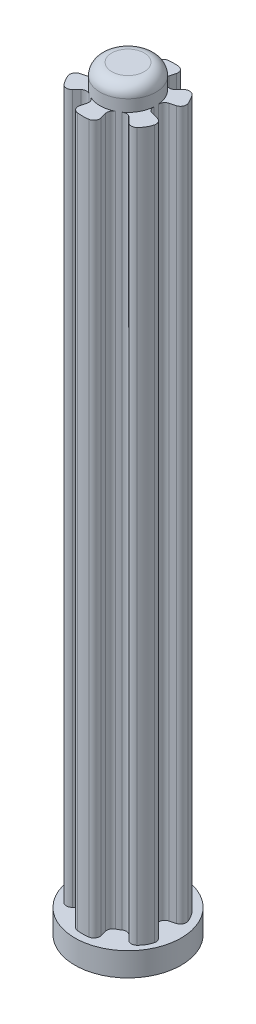
from build123d import *

# Parameters (mm, degrees)
BOSS_EXTRUDE1_DEPTH = 60
SKETCH3_R           = 4.5
BOSS_EXTRUDE2_DEPTH = 2
SKETCH4_R           = 2.375
BOSS_EXTRUDE3_DEPTH = 2
FILLET1_R           = 0.5
SKETCH6_R           = 1
CUT_EXTRUDE4_DEPTH  = 0.5
CUT_EXTRUDE4_DRAFT  = -50
FILLET2_R           = 1


with BuildPart() as part:
    # Sketch2 → Boss-Extrude1 (new body)
    with BuildSketch(Plane(origin=(0, 0, 0), x_dir=(1, 0, 0), z_dir=(0, 1, 0))):
        with BuildLine():
            Line((3.775215965, -0.978645895), (2.300774305, -0.58912019))
            ThreePointArc((2.300774305, -0.58912019), (2.374963211, 0.013219106), (2.294073837, 0.614695232))
            Line((2.294073837, 0.614695232), (3.742962577, 1.0029238))
            ThreePointArc((3.742962577, 1.0029238), (3.356294138, 1.936727823), (2.741299364, 2.73877761))
            Line((2.741299364, 2.73877761), (1.680151223, 1.678605632))
            ThreePointArc((1.680151223, 1.678605632), (1.187973207, 2.056537055), (0.614695232, 2.294073837))
            Line((0.614695232, 2.294073837), (1.0029238, 3.742962577))
            ThreePointArc((1.0029238, 3.742962577), (0, 3.875), (-1.0029238, 3.742962577))
            Line((-1.0029238, 3.742962577), (-0.614695232, 2.294073837))
            ThreePointArc((-0.614695232, 2.294073837), (-1.1875, 2.056810334), (-1.679378605, 1.679378605))
            Line((-1.679378605, 1.679378605), (-2.740038777, 2.740038777))
            ThreePointArc((-2.740038777, 2.740038777), (-3.35584844, 1.9375), (-3.742962577, 1.0029238))
            Line((-3.742962577, 1.0029238), (-2.294073837, 0.614695232))
            ThreePointArc((-2.294073837, 0.614695232), (-2.375, 0), (-2.294073837, -0.614695232))
            Line((-2.294073837, -0.614695232), (-3.742962577, -1.0029238))
            ThreePointArc((-3.742962577, -1.0029238), (-3.35584844, -1.9375), (-2.740038777, -2.740038777))
            Line((-2.740038777, -2.740038777), (-1.679378605, -1.679378605))
            ThreePointArc((-1.679378605, -1.679378605), (-1.1875, -2.056810334), (-0.614695232, -2.294073837))
            Line((-0.614695232, -2.294073837), (-1.0029238, -3.742962577))
            ThreePointArc((-1.0029238, -3.742962577), (0.033967076, -3.874851125), (1.068386506, -3.724805401))
            Line((1.068386506, -3.724805401), (0.681359786, -2.275164575))
            ThreePointArc((0.681359786, -2.275164575), (1.238849907, -2.026296106), (1.714477211, -1.643530618))
            Line((1.714477211, -1.643530618), (2.767163136, -2.698133353))
            ThreePointArc((2.767163136, -2.698133353), (3.500652231, -1.972912562), (3.775215965, -0.978645895))
        make_face()
        Polygon((0.085836926, -0.044584082), (0, 0), (0.073933818, 0), (0.104207494, -0.030328801), (0.080162685, -0.023330742), align=None, mode=Mode.SUBTRACT)
    extrude(amount=BOSS_EXTRUDE1_DEPTH)

    # Sketch3 → Boss-Extrude2 (add)
    with BuildSketch(Plane.XZ):
        with Locations(Location((0, 0, 0), (0, 0, 270))):
            Circle(SKETCH3_R)
    extrude(amount=BOSS_EXTRUDE2_DEPTH)

    # Sketch4 → Boss-Extrude3 (add)
    with BuildSketch(Plane(origin=(0, 60, 0), x_dir=(1, 0, 0), z_dir=(0, 1, 0))):
        with Locations(Location((0, 0, 0), (0, 0, 75))):
            Circle(SKETCH4_R)
    extrude(amount=BOSS_EXTRUDE3_DEPTH)

    # Fillet1
    # the kernel refuses this fillet: 0.5 mm, written as the material it adds along each edge
    with BuildSketch(Plane(origin=(-2.294073837, -1.140469783, 0.614695232), x_dir=(-0.965925826289068, 0, 0.2588190451025218), z_dir=(0, 1, 0)), Plane(origin=(-1.679378605, -1.140469783, -1.679378605), x_dir=(-0.7071067811865478, 0, -0.7071067811865474), z_dir=(0, 1, 0)), Plane(origin=(0.614695232, -1.140469783, -2.294073837), x_dir=(0.2588190451025215, 0, -0.9659258262890681), z_dir=(0, 1, 0)), Plane(origin=(2.294073837, -1.140469783, -0.614695232), x_dir=(0.9659258262890681, 0, -0.2588190451025215), z_dir=(0, 1, 0)), Plane(origin=(-0.614695232, -1.140469783, 2.294073837), x_dir=(-0.2588190451025215, 0, 0.9659258262890681), z_dir=(0, 1, 0))) as fillet1_piece_1:
        with BuildLine():
            CenterArc((0.456187913, -0.5), FILLET1_R, 90, 79.984589832)
            ThreePointArc((-0.036192593, -0.413043478), (-0.00906545, -0.20731306), (0, 0))
            Line((0, 0), (0.456187913, 0))
        make_face()
    extrude(amount=61.140469783)
    with BuildSketch(Plane(origin=(-2.294073837, -1.140469783, -0.614695232), x_dir=(-0.17351574004952178, 0, 0.9848310961556133), z_dir=(0, 1, 0)), Plane(origin=(-1.679378605, -1.140469783, 1.679378605), x_dir=(0.7661308776828862, 0, 0.6426845869171364), z_dir=(0, 1, 0))) as fillet1_piece_2:
        with BuildLine():
            CenterArc((0.458270974, -0.498091484), FILLET1_R, 95.007705084, 79.984589832)
            Line((-0.03982051, -0.45444663), (0, 0))
            ThreePointArc((0, 0), (0.20731306, -0.00906545), (0.414626119, 0))
        make_face()
    extrude(amount=61.140469783)
    with BuildSketch(Plane(origin=(-0.614695232, -1.140469783, -2.294073837), x_dir=(-0.258819045102522, 0, -0.965925826289068), z_dir=(0, 1, 0)), Plane(origin=(1.680151223, -1.140469783, -1.678605632), x_dir=(0.707432093873984, 0, -0.7067813187663288), z_dir=(0, 1, 0))) as fillet1_piece_3:
        with BuildLine():
            CenterArc((0.456187913, 0.5), FILLET1_R, 190.015410168, 79.984589832)
            ThreePointArc((-0.036192593, 0.413043478), (-0.00906545, 0.20731306), (0, 0))
            Line((0, 0), (0.456187913, 0))
        make_face()
    extrude(amount=61.140469783)
    with BuildSketch(Plane(origin=(2.300774305, -1.132506036, 0.58912019), x_dir=(0.16314582309469597, 0, -0.9866019665532569), z_dir=(0, 1, 0))) as fillet1_piece_4:
        with BuildLine():
            CenterArc((0.455070929, -0.498118095), FILLET1_R, 94.972648578, 79.61829146)
            Line((-0.042702606, -0.450985227), (0, 0))
            ThreePointArc((0, 0), (0.20586542, -0.008939048), (0.411730841, 0))
        make_face()
    extrude(amount=61.132506036)
    with BuildSketch(Plane(origin=(1.714477211, -1.163771178, 1.643530618), x_dir=(0.7064632978713467, 0, 0.7077496794494088), z_dir=(0, 1, 0))) as fillet1_piece_5:
        with BuildLine():
            CenterArc((0.465508471, -0.5), FILLET1_R, 90, 81.041880237)
            ThreePointArc((-0.02839274, -0.422143763), (-0.00477723, -0.211705398), (0, 0))
            Line((0, 0), (0.465508471, 0))
        make_face()
    extrude(amount=61.163771178)
    with BuildSketch(Plane(origin=(0.681359786, -1.109284133, 2.275164575), x_dir=(0.9301474254657973, 0, -0.3671862836481626), z_dir=(0, 1, 0))) as fillet1_piece_6:
        with BuildLine():
            CenterArc((0.445739753, -0.498194619), FILLET1_R, 94.870436099, 78.535607624)
            Line((-0.050952689, -0.440778436), (0, 0))
            ThreePointArc((0, 0), (0.201644174, -0.008575561), (0.403288348, 0))
        make_face()
    extrude(amount=61.109284133)
    # the kernel refuses this fillet: 0.5 mm, written as the material it takes off along each edge
    with BuildSketch(Plane(origin=(-2.740038777, 0, 2.740038777), x_dir=(-0.6526300069150477, 0, -0.7576767609436524), z_dir=(0, 1, 0)), Plane(origin=(-3.742962577, 0, -1.0029238), x_dir=(0.32985231937679765, 0, -0.9440325457322681), z_dir=(0, 1, 0)), Plane(origin=(-1.0029238, 0, -3.742962577), x_dir=(0.982482326291838, 0, -0.18635578478860887), z_dir=(0, 1, 0)), Plane(origin=(2.741299364, 0, -2.73877761), x_dir=(0.6522812796019254, 0, 0.7579769998363239), z_dir=(0, 1, 0))) as fillet1_2_piece_1:
        with BuildLine():
            CenterArc((0.538524723, -0.49861874), FILLET1_R, 85.740187873, 98.519624254)
            Line((0.039905983, -0.535758376), (0, 0))
            ThreePointArc((0, 0), (0.287832179, 0.010704768), (0.575664359, 0))
        make_face()
    extrude(amount=61.439160897, mode=Mode.SUBTRACT)
    with BuildSketch(Plane(origin=(-3.742962577, 0, 1.0029238), x_dir=(0.9659258262890679, 0, -0.2588190451025218), z_dir=(0, 1, 0)), Plane(origin=(-2.740038777, 0, -2.740038777), x_dir=(0.7071067811865476, 0, 0.7071067811865476), z_dir=(0, 1, 0)), Plane(origin=(1.0029238, 0, -3.742962577), x_dir=(-0.25881904510252196, 0, 0.965925826289068), z_dir=(0, 1, 0)), Plane(origin=(3.742962577, 0, -1.0029238), x_dir=(-0.9659258262890681, 0, 0.25881904510252185), z_dir=(0, 1, 0)), Plane(origin=(-1.0029238, 0, 3.742962577), x_dir=(0.2588190451025216, 0, -0.9659258262890681), z_dir=(0, 1, 0))) as fillet1_2_piece_2:
        with BuildLine():
            CenterArc((0.537242519, -0.5), FILLET1_R, 90, 98.519624254)
            ThreePointArc((0.04275993, -0.574074074), (0.010704768, -0.287832179), (0, 0))
            Line((0, 0), (0.537242519, 0))
        make_face()
    extrude(amount=61.439160897, mode=Mode.SUBTRACT)
    with BuildSketch(Plane(origin=(3.775215965, 0, 0.978645895), x_dir=(-0.13498089829276533, 0, 0.9908482008340522), z_dir=(0, 1, 0))) as fillet1_2_piece_3:
        with BuildLine():
            CenterArc((0.442538799, -0.49598715), FILLET1_R, 82.736098253, 90.22281865)
            Line((-0.053690457, -0.434696649), (0, 0))
            ThreePointArc((0, 0), (0.252879314, 0.016051399), (0.505758627, 0))
        make_face()
    extrude(amount=61.264396568, mode=Mode.SUBTRACT)
    with BuildSketch(Plane(origin=(2.767163136, 0, 2.698133353), x_dir=(0.8000663385432955, 0, -0.5999115384203949), z_dir=(0, 1, 0))) as fillet1_2_piece_4:
        with BuildLine():
            CenterArc((0.434547354, 0.496131331), FILLET1_R, 188.084320914, 89.047719887)
            Line((-0.060483736, 0.425816179), (0, 0))
            ThreePointArc((0, 0), (0.248312773, -0.015474675), (0.496625547, 0))
        make_face()
    extrude(amount=61.241563867, mode=Mode.SUBTRACT)
    with BuildSketch(Plane(origin=(1.068386506, 0, 3.724805401), x_dir=(-0.9787647804449897, 0, 0.20498659605074468), z_dir=(0, 1, 0))) as fillet1_2_piece_5:
        with BuildLine():
            CenterArc((0.527919562, -0.498672678), FILLET1_R, 85.824226653, 97.295295094)
            Line((0.028660468, -0.525882193), (0, 0))
            ThreePointArc((0, 0), (0.282163904, 0.010286747), (0.564327807, 0))
        make_face()
    extrude(amount=61.410819518, mode=Mode.SUBTRACT)


with BuildPart() as cut_extrude4_tool:
    # Sketch6 → Cut-Extrude4 (with draft: the straight prism first)
    with BuildSketch(Plane.XZ.offset(2)):
        Circle(SKETCH6_R)
    extrude(amount=-CUT_EXTRUDE4_DEPTH)
    # Cut-Extrude4: the draft: its side faces are tilted about the plane it starts from
    cut_extrude4_sides = [cut_extrude4_tool.faces().sort_by_distance(p)[0] for p in [
        (-1, -1.75, 0),
    ]]
    draft(cut_extrude4_sides, Plane.XZ.offset(2), CUT_EXTRUDE4_DRAFT)


with BuildPart() as part_1:
    add(part.part)

    # Cut-Extrude4: cut by cut_extrude4_tool
    add(cut_extrude4_tool.part, mode=Mode.SUBTRACT)

    # Fillet2
    fillet2_edges = [part_1.edges().sort_by_distance(p)[0] for p in [
        (-0.614695232, 62, 2.294073837),
    ]]
    fillet(fillet2_edges, radius=FILLET2_R)


solid = part_1.part
